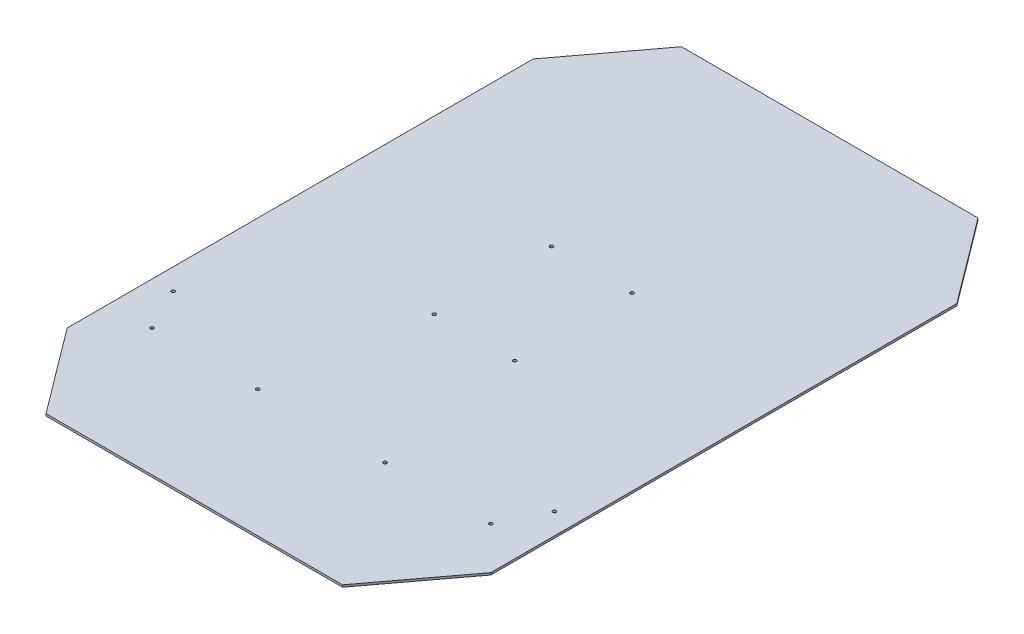
from build123d import *

# Parameters (mm, degrees)
BOSS_EXTRUDE1_DEPTH = 5
SKETCH2_R           = 4
CUT_EXTRUDE1_DEPTH  = 902.401686264
SKETCH3_R           = 4
CUT_EXTRUDE2_DEPTH  = 10


with BuildPart() as part:
    # Sketch1 → Boss-Extrude1 (new body)
    with BuildSketch(Plane(origin=(0, 0, 0), x_dir=(1, 0, 0), z_dir=(0, 1, 0))):
        Polygon((-350, 750), (-500, 550), (-500, -550), (-350, -750), (350, -750), (500, -550), (500, 550), (350, 750), align=None)
    extrude(amount=BOSS_EXTRUDE1_DEPTH)

    # Sketch2 → Cut-Extrude1 (cut, through all)
    with BuildSketch(Plane(origin=(0, 5, 0), x_dir=(1, 0, 0), z_dir=(0, 1, 0))):
        with Locations((95, 188.5)):
            Circle(SKETCH2_R)
        with Locations((-95, 188.5)):
            Circle(SKETCH2_R)
        with Locations((95, -88.5)):
            Circle(SKETCH2_R)
        with Locations((-95, -88.5)):
            Circle(SKETCH2_R)
    extrude(amount=-CUT_EXTRUDE1_DEPTH, mode=Mode.SUBTRACT)

    # Sketch3 → Cut-Extrude2 (cut)
    with BuildSketch(Plane.XZ):
        with Locations((-400, 450)):
            Circle(SKETCH3_R)
        with Locations((-450, 350)):
            Circle(SKETCH3_R)
        with Locations((-150, 450)):
            Circle(SKETCH3_R)
        with Locations((450, 350)):
            Circle(SKETCH3_R)
        with Locations((150, 450)):
            Circle(SKETCH3_R)
        with Locations((400, 450)):
            Circle(SKETCH3_R)
    extrude(amount=-CUT_EXTRUDE2_DEPTH, mode=Mode.SUBTRACT)


solid = part.part
